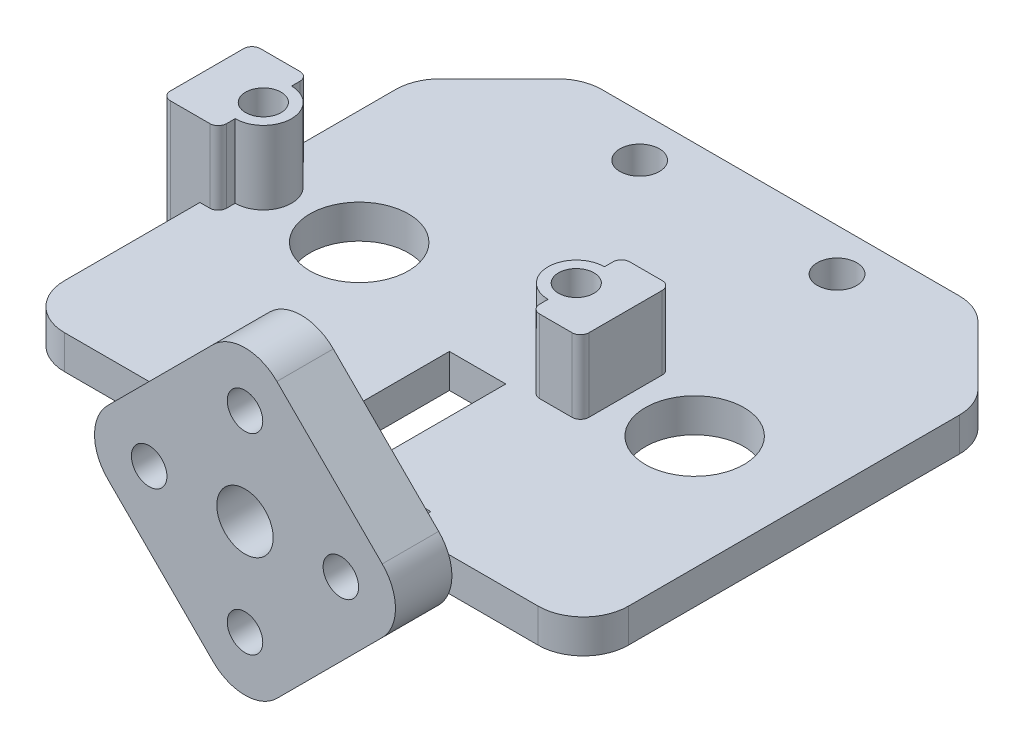
from build123d import *

# Parameters (mm, degrees)
BOSS_EXTRUDE1_DEPTH      = 1.5
BOSS_EXTRUDE1_DEPTH_BACK = 1.5
SKETCH1_W                = 5
SKETCH1_H                = 13.727853371
SKETCH1_R                = 4.375
SKETCH1_R_2              = 1.75
BOSS_EXTRUDE2_DEPTH      = 15
BOSS_EXTRUDE2_DEPTH_BACK = 15
SKETCH2_R                = 1.575
SKETCH2_R_2              = 2.5
CUT_EXTRUDE1_DEPTH       = 7.5
CUT_EXTRUDE2_DEPTH       = 5
BOSS_EXTRUDE3_DEPTH      = 8
BOSS_EXTRUDE3_DEPTH_BACK = 1.5
SKETCH1_4_R              = 1.575
FILLET1_R                = 4
FILLET2_R                = 0.75


with BuildPart() as part:
    # Sketch1 → Boss-Extrude1 (new, two sides: drawn at the far end of the back side and taken through both)
    with BuildSketch(Plane(origin=(0, 0, 0), x_dir=(1, 0, 0), z_dir=(0, 1, 0)).offset(-BOSS_EXTRUDE1_DEPTH_BACK)):
        with BuildLine():
            ThreePointArc((-23.375, 2.5), (-21.607233047, 1.767766953), (-20.875, 0))
            ThreePointArc((-20.875, 0), (-21.607233047, -1.767766953), (-23.375, -2.5))
            Line((-23.375, -2.5), (-23.375, -4))
            Line((-23.375, -4), (-25, -4))
            Line((-25, -4), (-25, -20))
            Line((-25, -20), (25, -20))
            Line((25, -20), (25, 15))
            Line((25, 15), (17.5, 22.5))
            Line((17.5, 22.5), (-17.5, 22.5))
            Line((-17.5, 22.5), (-25, 15))
            Line((-25, 15), (-25, 4))
            Line((-25, 4), (-23.375, 4))
            Line((-23.375, 4), (-23.375, 2.5))
        make_face()
        with Locations((0, -11.238926686)):
            Rectangle(SKETCH1_W, SKETCH1_H, mode=Mode.SUBTRACT)
        with BuildLine():
            ThreePointArc((-10.5, 0), (-14.875, -4.375), (-19.25, 0))
            ThreePointArc((-19.25, 0), (-17.968592168, 3.093592168), (-14.875, 4.375))
            ThreePointArc((-14.875, 4.375), (-11.781407832, 3.093592168), (-10.5, 0))
        make_face(mode=Mode.SUBTRACT)
        with BuildLine():
            ThreePointArc((4.375, -2.5), (2.607233047, -1.767766953), (1.875, 0))
            ThreePointArc((1.875, 0), (2.607233047, 1.767766953), (4.375, 2.5))
            Line((4.375, 2.5), (4.375, 4))
            Line((4.375, 4), (8.75, 4))
            Line((8.75, 4), (8.75, 0))
            Line((8.75, 0), (8.75, -4))
            Line((8.75, -4), (4.375, -4))
            Line((4.375, -4), (4.375, -2.5))
        make_face(mode=Mode.SUBTRACT)
        with Locations(Location((14.875, 0, 0), (0, 0, 270))):
            Circle(SKETCH1_R, mode=Mode.SUBTRACT)
        with Locations(Location((-8.75, 18.75, 0), (0, 0, 270))):
            Circle(SKETCH1_R_2, mode=Mode.SUBTRACT)
        with Locations(Location((8.75, 18.75, 0), (0, 0, 270))):
            Circle(SKETCH1_R_2, mode=Mode.SUBTRACT)
    extrude(amount=BOSS_EXTRUDE1_DEPTH + BOSS_EXTRUDE1_DEPTH_BACK)

    # Sketch1<3> → Boss-Extrude2 (add, two sides: drawn at the far end of the back side and taken through both)
    with BuildSketch(Plane(origin=(0, 0, 0), x_dir=(1, 0, 0), z_dir=(0, 1, 0)).offset(-BOSS_EXTRUDE2_DEPTH_BACK)):
        Polygon((0, -20), (-25, -20), (-25, -25), (25, -25), (25, -20), align=None)
    extrude(amount=BOSS_EXTRUDE2_DEPTH + BOSS_EXTRUDE2_DEPTH_BACK)

    # Sketch2 → Cut-Extrude1 (cut)
    with BuildSketch(Plane.XY.offset(25)):
        with Locations((-8.5, 0)):
            Circle(SKETCH2_R)
        Circle(SKETCH2_R_2)
        with Locations((0, 8.5)):
            Circle(SKETCH2_R)
        with Locations((8.5, 0)):
            Circle(SKETCH2_R)
        with Locations((0, -8.5)):
            Circle(SKETCH2_R)
    extrude(amount=-CUT_EXTRUDE1_DEPTH, mode=Mode.SUBTRACT)

    # Sketch2<3> → Cut-Extrude2 (cut)
    with BuildSketch(Plane.XY.offset(25)):
        Polygon((-25, 0), (-15, 0), (0, 15), (-25, 15), align=None)
        Polygon((25, 15), (0, 15), (15, 0), (0, -15), (25, -15), align=None)
        Polygon((0, -15), (-15, 0), (-25, 0), (-25, -15), align=None)
    extrude(amount=-CUT_EXTRUDE2_DEPTH, mode=Mode.SUBTRACT)

    # Sketch1<4> → Boss-Extrude3 (add, two sides: drawn at the far end of the back side and taken through both)
    # profile 1 of 2: a face of its own
    with BuildSketch(Plane(origin=(0, 0, 0), x_dir=(1, 0, 0), z_dir=(0, 1, 0)).offset(-BOSS_EXTRUDE3_DEPTH_BACK)):
        with BuildLine():
            ThreePointArc((4.375, 2.5), (1.875, 0), (4.375, -2.5))
            Line((4.375, -2.5), (4.375, -4))
            Line((4.375, -4), (8.75, -4))
            Line((8.75, -4), (8.75, 4))
            Line((8.75, 4), (4.375, 4))
            Line((4.375, 4), (4.375, 2.5))
        make_face()
        with Locations(Location((4.375, 0, 0), (0, 0, 270))):
            Circle(SKETCH1_4_R, mode=Mode.SUBTRACT)
    # profile 2 of 2: a face of its own
    with BuildSketch(Plane(origin=(0, 0, 0), x_dir=(1, 0, 0), z_dir=(0, 1, 0)).offset(-BOSS_EXTRUDE3_DEPTH_BACK)):
        with BuildLine():
            ThreePointArc((-23.375, -2.5), (-20.875, 0), (-23.375, 2.5))
            Line((-23.375, 2.5), (-23.375, 4))
            Line((-23.375, 4), (-28.375, 4))
            Line((-28.375, 4), (-28.375, -4))
            Line((-28.375, -4), (-23.375, -4))
            Line((-23.375, -4), (-23.375, -2.5))
        make_face()
        with Locations(Location((-23.375, 0, 0), (0, 0, 270))):
            Circle(SKETCH1_4_R, mode=Mode.SUBTRACT)
    extrude(amount=BOSS_EXTRUDE3_DEPTH + BOSS_EXTRUDE3_DEPTH_BACK)

    # Fillet1
    # the kernel refuses this fillet: 4 mm, written as the material it takes off along each edge
    with BuildSketch(Plane(origin=(15, 0, 35), x_dir=(-0.7071067811865535, -0.7071067811865416, 0), z_dir=(0, 0, -1))) as fillet1_piece_1:
        with BuildLine():
            CenterArc((FILLET1_R, FILLET1_R), FILLET1_R, 180, 90)
            Line((0, FILLET1_R), (0, 0))
            Line((0, 0), (FILLET1_R, 0))
        make_face()
    extrude(amount=15, mode=Mode.SUBTRACT)
    with BuildSketch(Plane(origin=(0, 15, 35), x_dir=(0.7071067811865505, -0.7071067811865446, 0), z_dir=(0, 0, -1))) as fillet1_piece_2:
        with BuildLine():
            CenterArc((FILLET1_R, FILLET1_R), FILLET1_R, 180, 90)
            Line((0, FILLET1_R), (0, 0))
            Line((0, 0), (FILLET1_R, 0))
        make_face()
    extrude(amount=25, mode=Mode.SUBTRACT)
    with BuildSketch(Plane(origin=(25, -11.5, 20), x_dir=(0, 0, -1), z_dir=(0, 1, 0)), Plane(origin=(-25, -11.5, 20), x_dir=(1, 0, 0), z_dir=(0, 1, 0))) as fillet1_piece_3:
        with BuildLine():
            CenterArc((FILLET1_R, FILLET1_R), FILLET1_R, 180, 90)
            Line((0, FILLET1_R), (0, 0))
            Line((0, 0), (FILLET1_R, 0))
        make_face()
    extrude(amount=23, mode=Mode.SUBTRACT)
    with BuildSketch(Plane(origin=(0, -15, 35), x_dir=(0.7071067811865533, 0.7071067811865418, 0), z_dir=(0, 0, -1))) as fillet1_piece_4:
        with BuildLine():
            CenterArc((FILLET1_R, -FILLET1_R), FILLET1_R, 90, 90)
            Line((0, -FILLET1_R), (0, 0))
            Line((0, 0), (FILLET1_R, 0))
        make_face()
    extrude(amount=25, mode=Mode.SUBTRACT)
    with BuildSketch(Plane(origin=(-15, 0, 35), x_dir=(0.7071067811865416, -0.7071067811865536, 0), z_dir=(0, 0, -1))) as fillet1_piece_5:
        with BuildLine():
            CenterArc((FILLET1_R, -FILLET1_R), FILLET1_R, 90, 90)
            Line((0, -FILLET1_R), (0, 0))
            Line((0, 0), (FILLET1_R, 0))
        make_face()
    extrude(amount=15, mode=Mode.SUBTRACT)
    with BuildSketch(Plane(origin=(-25, -5.642135624, -15), x_dir=(0, 0, 1), z_dir=(0, 1, 0)), Plane(origin=(-17.5, -5.642135624, -22.5), x_dir=(-0.7071067811865465, 0, 0.7071067811865487), z_dir=(0, 1, 0)), Plane(origin=(25, 5.642135624, -15), x_dir=(0, 0, 1), z_dir=(0, -1, 0))) as fillet1_piece_6:
        with BuildLine():
            CenterArc((FILLET1_R * 0.414213562373, FILLET1_R), FILLET1_R, 225, 45)
            Line((-FILLET1_R * 0.292893218813, FILLET1_R * 0.292893218813), (0, 0))
            Line((0, 0), (FILLET1_R * 0.414213562373, 0))
        make_face()
    extrude(amount=11.284271247, mode=Mode.SUBTRACT)
    with BuildSketch(Plane(origin=(17.5, -5.642135624, -22.5), x_dir=(0.7071067811865454, 0, 0.7071067811865497), z_dir=(0, 1, 0))) as fillet1_piece_7:
        with BuildLine():
            CenterArc((FILLET1_R * 0.414213562373, -FILLET1_R), FILLET1_R, 90, 45)
            Line((-FILLET1_R * 0.292893218813, -FILLET1_R * 0.292893218813), (0, 0))
            Line((0, 0), (FILLET1_R * 0.414213562373, 0))
        make_face()
    extrude(amount=11.284271247, mode=Mode.SUBTRACT)

    # Fillet2
    fillet2_edges = [part.edges().sort_by_distance(p)[0] for p in [
        (8.75, 4.75, -4),
        (8.75, 4.75, 4),
        (4.375, 4.75, 4),
        (4.375, 4.75, -4),
        (-28.375, 3.25, 4),
        (-28.375, 3.25, -4),
        (-23.375, 4.75, -4),
        (-23.375, 4.75, 4),
    ]]
    fillet(fillet2_edges, radius=FILLET2_R)


solid = part.part
